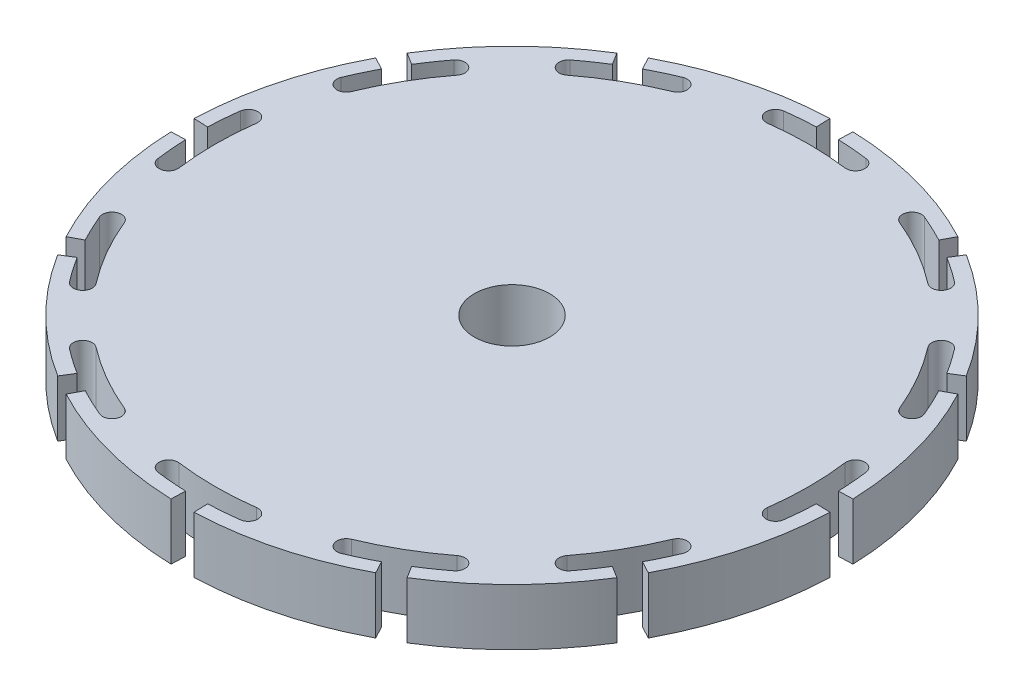
from build123d import *

# Parameters (mm, degrees)
SKETCH1_R         = 35
WHEEL_BLANK_DEPTH = 6
T_SLOT_DEPTH      = 50.859803449
CIRPATTERN1_COUNT = 12
SKETCH3_R         = 4
CENTER_HOLE_DEPTH = 6


with BuildPart() as part:
    # Sketch1 → Wheel Blank (new body)
    with BuildSketch(Plane(origin=(0, 0, 0), x_dir=(1, 0, 0), z_dir=(0, 1, 0))):
        Circle(SKETCH1_R)
    extrude(amount=WHEEL_BLANK_DEPTH)

    # Sketch2 → T-Slot (cut, through all)
    with BuildSketch(Plane(origin=(0, 0, 0), x_dir=(1, 0, 0), z_dir=(0, 1, 0))):
        with BuildLine():
            Line((-1.221482385, 34.978678946), (-1.16913314, 33.479592705))
            ThreePointArc((-1.16913314, 33.479592705), (-2.774074952, 33.384944334), (-4.372627439, 33.213402856))
            ThreePointArc((-4.372627439, 33.213402856), (-5.233546109, 32.091431802), (-4.111575055, 31.230513133))
            ThreePointArc((-4.111575055, 31.230513133), (0, 31.5), (4.111575055, 31.230513133))
            ThreePointArc((4.111575055, 31.230513133), (5.233546109, 32.091431802), (4.372627439, 33.213402856))
            ThreePointArc((4.372627439, 33.213402856), (2.774074952, 33.384944334), (1.16913314, 33.479592705))
            Line((1.16913314, 33.479592705), (1.221482385, 34.978678946))
            ThreePointArc((1.221482385, 34.978678946), (0, 35), (-1.221482385, 34.978678946))
        make_face()
    t_slot = extrude(amount=T_SLOT_DEPTH, mode=Mode.SUBTRACT)

    # CirPattern1: T-Slot ×12 about axis
    cirpattern1_axis = Axis((0, 6, 0), (0, -1, 0))
    for i in range(1, CIRPATTERN1_COUNT):
        add(t_slot.rotate(cirpattern1_axis, i * 360 / CIRPATTERN1_COUNT), mode=Mode.SUBTRACT)

    # Sketch3 → Center Hole (cut)
    with BuildSketch(Plane(origin=(0, 0, 0), x_dir=(1, 0, 0), z_dir=(0, 1, 0))):
        Circle(SKETCH3_R)
    extrude(amount=CENTER_HOLE_DEPTH, mode=Mode.SUBTRACT)


solid = part.part
